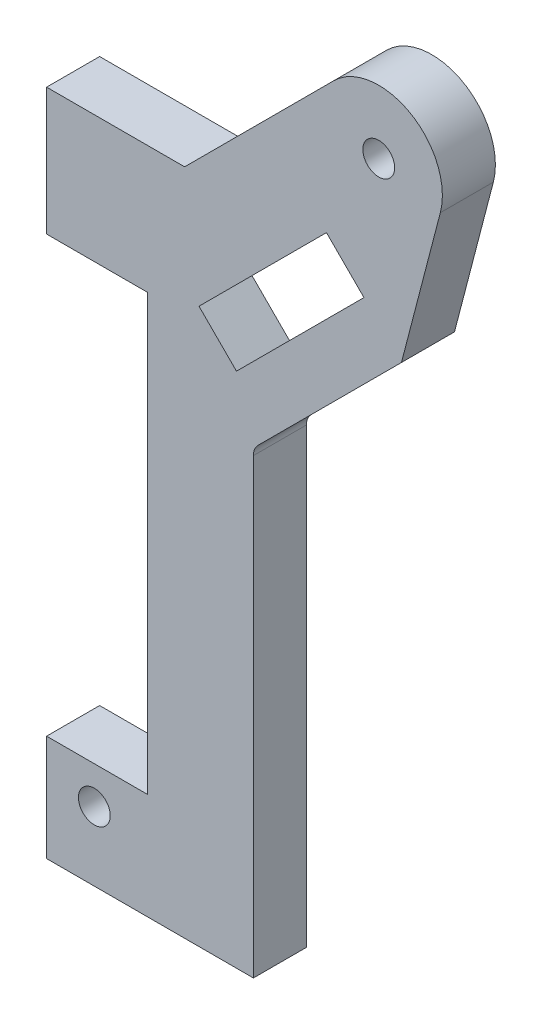
from build123d import *

# Parameters (mm, degrees)
ESQUISSE1_R        = 1.5
BOSS_EXTRU_1_DEPTH = 5
CONG_3_R           = 1.5


with BuildPart() as part:
    # Esquisse1 → Boss.-Extru.1 (new body)
    with BuildSketch(Plane.XY):
        with BuildLine():
            Line((20, 51), (20, 10))
            Line((20, 10), (10.5, 10))
            Line((10.5, 10), (10.5, 7))
            Line((10.5, 7), (10.5, 0))
            Line((10.5, 0), (30, 0))
            Line((30, 0), (30, 43.28152075))
            Line((30, 43.28152075), (43.961530357, 57.243051107))
            Line((43.961530357, 57.243051107), (47.625955009, 71.306985316))
            ThreePointArc((47.625955009, 71.306985316), (44.801829917, 78.026294211), (37.577164466, 77.062445841))
            Line((37.577164466, 77.062445841), (23.514718626, 63))
            Line((23.514718626, 63), (10.5, 63))
            Line((10.5, 63), (10.5, 54))
            Line((10.5, 54), (10.5, 51))
            Line((10.5, 51), (20, 51))
        make_face()
        with Locations((15, 6.5)):
            Circle(ESQUISSE1_R, mode=Mode.SUBTRACT)
        Polygon((24.869647265, 52.293303639), (36.890462545, 64.314118919), (40.425996451, 60.778585013), (28.405181171, 48.757769733), align=None, mode=Mode.SUBTRACT)
        with Locations((41.819805153, 72.819805153)):
            Circle(ESQUISSE1_R, mode=Mode.SUBTRACT)
    extrude(amount=BOSS_EXTRU_1_DEPTH)

    # Congé3
    cong_3_edges = [part.edges().sort_by_distance(p)[0] for p in [
        (30, 43.28152075, 2.5),
    ]]
    fillet(cong_3_edges, radius=CONG_3_R)


solid = part.part
